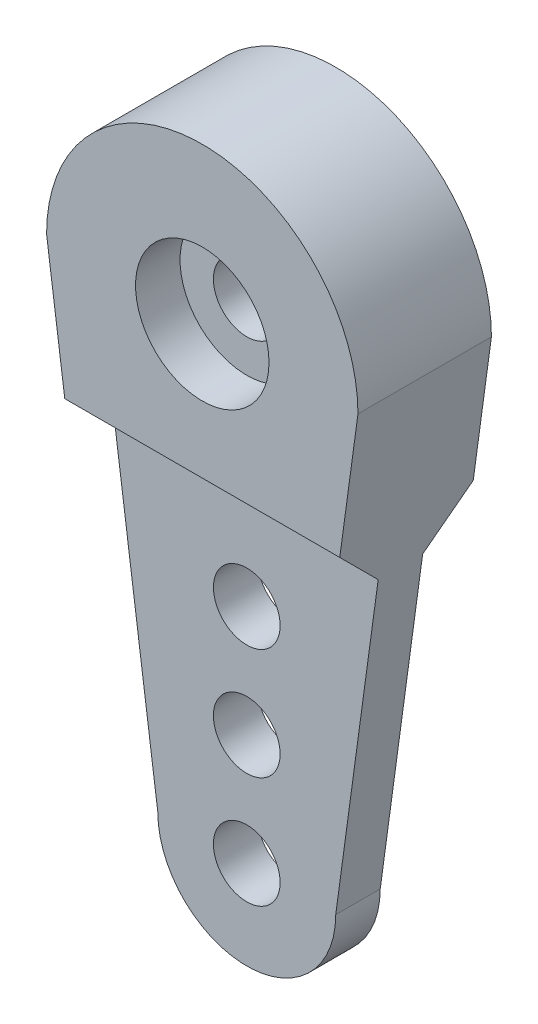
from build123d import *

# Parameters (mm, degrees)
BOSS_EXTRUDE1_DEPTH = 1
SKETCH2_R           = 3
BOSS_EXTRUDE2_DEPTH = 3
CHAMFER1_SIZE       = 2
SKETCH3_R           = 1.5
CUT_EXTRUDE1_DEPTH  = 28.221315178
SKETCH4_R           = 1.5
CUT_EXTRUDE2_DEPTH  = 28.221315178


with BuildPart() as part:
    # Sketch1 → Boss-Extrude1 (new, symmetric)
    with BuildSketch(Plane.XY):
        with BuildLine():
            Line((-7, 0), (-4, -22))
            ThreePointArc((-4, -22), (0, -26), (4, -22))
            Line((4, -22), (7, 0))
            ThreePointArc((7, 0), (0, 7), (-7, 0))
        make_face()
    extrude(amount=BOSS_EXTRUDE1_DEPTH, both=True)

    # Sketch2 → Boss-Extrude2 (add, symmetric)
    with BuildSketch(Plane.XY):
        with BuildLine():
            Line((5.909090909, -8), (7, 0))
            ThreePointArc((7, 0), (0, 7), (-7, 0))
            Line((-7, 0), (-5.909090909, -8))
            Line((-5.909090909, -8), (5.909090909, -8))
        make_face()
        Circle(SKETCH2_R, mode=Mode.SUBTRACT)
    extrude(amount=BOSS_EXTRUDE2_DEPTH, both=True)

    # Chamfer1
    chamfer1_edges = [part.edges().sort_by_distance(p)[0] for p in [
        (0, -8, -3),
        (0, -8, 3),
    ]]
    chamfer(chamfer1_edges, length=CHAMFER1_SIZE - 0.0001)  # a hair under: the kernel refuses the full size

    # Sketch3 → Cut-Extrude1 (cut, through all)
    with BuildSketch(Plane.XY.offset(1)):
        with Locations((0, -22)):
            Circle(SKETCH3_R)
        with Locations((0, -17)):
            Circle(SKETCH3_R)
        with Locations((0, -12)):
            Circle(SKETCH3_R)
    extrude(amount=-CUT_EXTRUDE1_DEPTH, mode=Mode.SUBTRACT)

    # Sketch4 → Cut-Extrude2 (cut, through all)
    with BuildSketch(Plane.XY.offset(1)):
        Circle(SKETCH4_R)
    extrude(amount=-CUT_EXTRUDE2_DEPTH, mode=Mode.SUBTRACT)


solid = part.part
